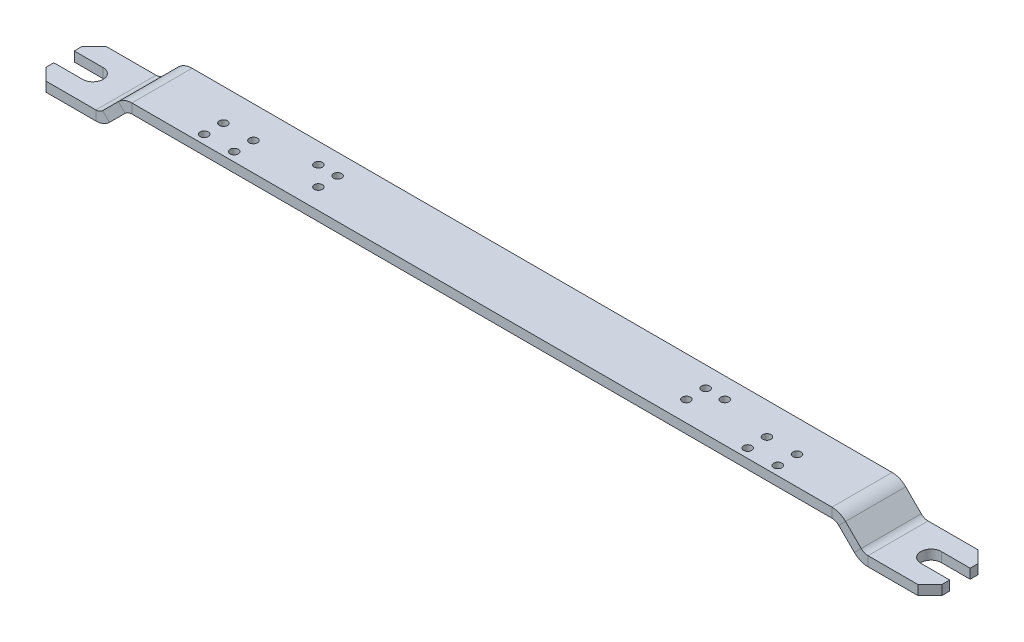
from build123d import *

# Parameters (mm, degrees)
SKETCH_1_W             = 372.5
SKETCH_1_H             = 50
SM_BASE_FLANGE_1_DEPTH = 8
OTHER_START            = -25
OTHER_1_DEPTH          = 50
OTHER_1_2_DEPTH        = 50
CHAMFER_1_SIZE         = 10
CUT_EXTRUDE_1_DEPTH    = 374.873307418
M8X1_251_D             = 6.8
M8X1_251_CSINK_D       = 8.5
M8X1_251_CSINK_ANGLE   = 90


# Read off the part's stored shape, not the designer's step: Изгиб1
# Sheet-metal steps are written as plain solids
with BuildPart() as part:
    # Sketch 1 → Базовая кромка1 (new body)
    with BuildSketch(Plane(origin=(0, 0, 0), x_dir=(1, 0, 0), z_dir=(0, 1, 0))):
        with Locations((-186.25, 0)):
            Rectangle(SKETCH_1_W, SKETCH_1_H)
    extrude(amount=SM_BASE_FLANGE_1_DEPTH)

    # Other 1 outline → Other 1 (cut)
    with BuildSketch(Plane.XY.offset(OTHER_START)):
        with BuildLine():
            Line((-306.372583002, 8), (-309.68629166, 4.68629166))
            ThreePointArc((-309.68629166, 4.68629166), (-314.877065168, 1.217927687), (-321, 2.25e-07))
            Line((-321, 2.25e-07), (0, 0))
            Line((0, 0), (0, 8))
            Line((0, 8), (-306.372583002, 8))
        make_face()
    extrude(amount=OTHER_1_DEPTH, mode=Mode.SUBTRACT)

    # Other 1 2 outline → Other 1 2 (add)
    with BuildSketch(Plane.XY.offset(OTHER_START)):
        with BuildLine():
            Line((-321, 8.000000225), (-306.372583002, 8))
            Line((-306.372583002, 8), (-296.715728655, 17.656854152))
            ThreePointArc((-296.715728655, 17.656854152), (-294.120341909, 19.391036132), (-291.058874503, 19.999999862))
            Line((-291.058874503, 19.999999862), (0, 20))
            Line((0, 20), (0, 28))
            Line((0, 28), (-291.058874503, 27.999999862))
            ThreePointArc((-291.058874503, 27.999999862), (-297.181809368, 26.782072393), (-302.372582904, 23.313708401))
            Line((-302.372582904, 23.313708401), (-315.343145909, 10.343145909))
            ThreePointArc((-315.343145909, 10.343145909), (-317.938532627, 8.608963948), (-321, 8.000000225))
        make_face()
    extrude(amount=OTHER_1_2_DEPTH)

    # Фаска1
    chamfer_1_edges = [part.edges().sort_by_distance(p)[0] for p in [
        (-372.5, 4, -25),
        (-372.5, 4, 25),
    ]]
    chamfer(chamfer_1_edges, length=CHAMFER_1_SIZE)

    # Эскиз4 → Вытянуть1 (cut, through all)
    with BuildSketch(Plane(origin=(0, 8, 0), x_dir=(1, 0, 0), z_dir=(0, 1, 0))):
        with BuildLine():
            Line((-348.5, 8.5), (-372.5, 8.5))
            Line((-372.5, 8.5), (-372.5, -8.5))
            Line((-372.5, -8.5), (-348.5, -8.5))
            ThreePointArc((-348.5, -8.5), (-340, 0), (-348.5, 8.5))
        make_face()
    extrude(amount=-CUT_EXTRUDE_1_DEPTH, mode=Mode.SUBTRACT)

    # Зеркальное отражение1: part across plane


with BuildPart() as part_1:
    add(part.part)
    add(part.part.mirror(Plane(origin=(0, 28, -25), x_dir=(0, 0, 1), z_dir=(-1, 0, 0))))

    # Отверстие обработанное метчиком M8x1.251 (through all)
    with Locations(Plane.XZ.offset(-20)):
        with Locations((-238.5, 17.5), (-238.5, 1.5), (-213.5, 1.5), (-213.5, 17.5), (-153, -8), (-153, 8), (-169, -8), (213.5, 1.5), (238.5, 1.5), (238.5, 17.5), (213.5, 17.5), (169, -8), (153, -8), (153, 8)):
            CounterSinkHole(M8X1_251_D / 2, M8X1_251_CSINK_D / 2, counter_sink_angle=M8X1_251_CSINK_ANGLE)


solid = part_1.part
